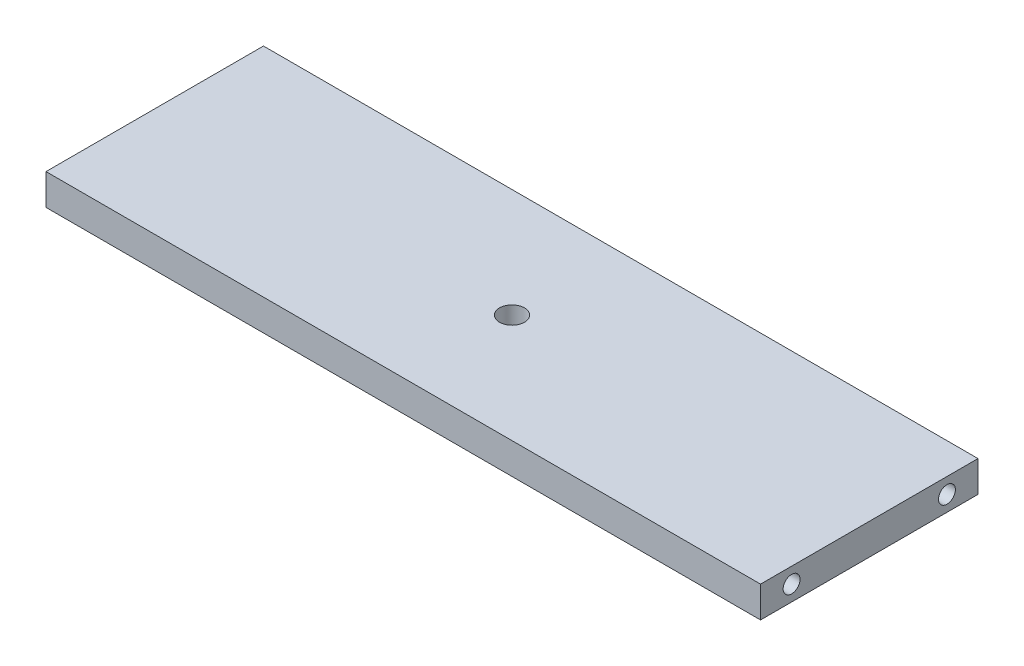
from build123d import *

# Parameters (mm, degrees)
SKETCH2_W                      = 146.05
SKETCH2_H                      = 44.45
BOSS_EXTRUDE1_DEPTH            = 6.35
F_1_4_20_TAPPED_HOLE1_D        = 5.1054
F_8_32_TAPPED_HOLE1_AT_2_COUNT = 2
F_8_32_TAPPED_HOLE1_AT_2_PITCH = 31.75


with BuildPart() as part:
    # Sketch2 → Boss-Extrude1 (new body)
    with BuildSketch(Plane(origin=(0, 0, 0), x_dir=(1, 0, 0), z_dir=(0, 1, 0))):
        Rectangle(SKETCH2_W, SKETCH2_H)
    extrude(amount=BOSS_EXTRUDE1_DEPTH)

    # 1/4-20 Tapped Hole1 (through all)
    with Locations(Plane(origin=(0, 0, 0), x_dir=(-1, 0, 0), z_dir=(0, -1, 0))):
        with Locations((0, 0)):
            Hole(F_1_4_20_TAPPED_HOLE1_D / 2)

    # Sketch7 → #8-32 Tapped Hole1 (revolve, cut)
    with BuildSketch(Plane(origin=(-73.025, 3.175, -15.875), x_dir=(0, 0, 1), z_dir=(0, 1, 0))):
        Polygon((0, 0), (0, 7.387806461), (1.7272, 6.35), (1.7272, 0), align=None)
    f_8_32_tapped_hole1 = revolve(axis=Axis((-79.375, 3.175, -15.875), (1, 0, 0)), mode=Mode.SUBTRACT)

    # #8-32 Tapped Hole1 at 2: #8-32 Tapped Hole1 ×2
    with Locations(*[(0, 0, i * F_8_32_TAPPED_HOLE1_AT_2_PITCH) for i in range(1, F_8_32_TAPPED_HOLE1_AT_2_COUNT)]):
        add(f_8_32_tapped_hole1, mode=Mode.SUBTRACT)

    # Mirror1: #8-32 Tapped Hole1 across plane
    add(f_8_32_tapped_hole1.mirror(Plane(origin=(0, 0, 0), x_dir=(0, 0, 1), z_dir=(1, 0, 0))), mode=Mode.SUBTRACT)

    # Mirror1 copy 1 sketch → Mirror1 copy 1 (revolve, cut)
    with BuildSketch(Plane(origin=(73.025, 3.175, 15.875), x_dir=(0, 0, 1), z_dir=(0, 1, 0))):
        Polygon((0, 0), (0, -7.387806461), (1.7272, -6.35), (1.7272, 0), align=None)
    revolve(axis=Axis((79.375, 3.175, 15.875), (1, 0, 0)), mode=Mode.SUBTRACT)


solid = part.part
